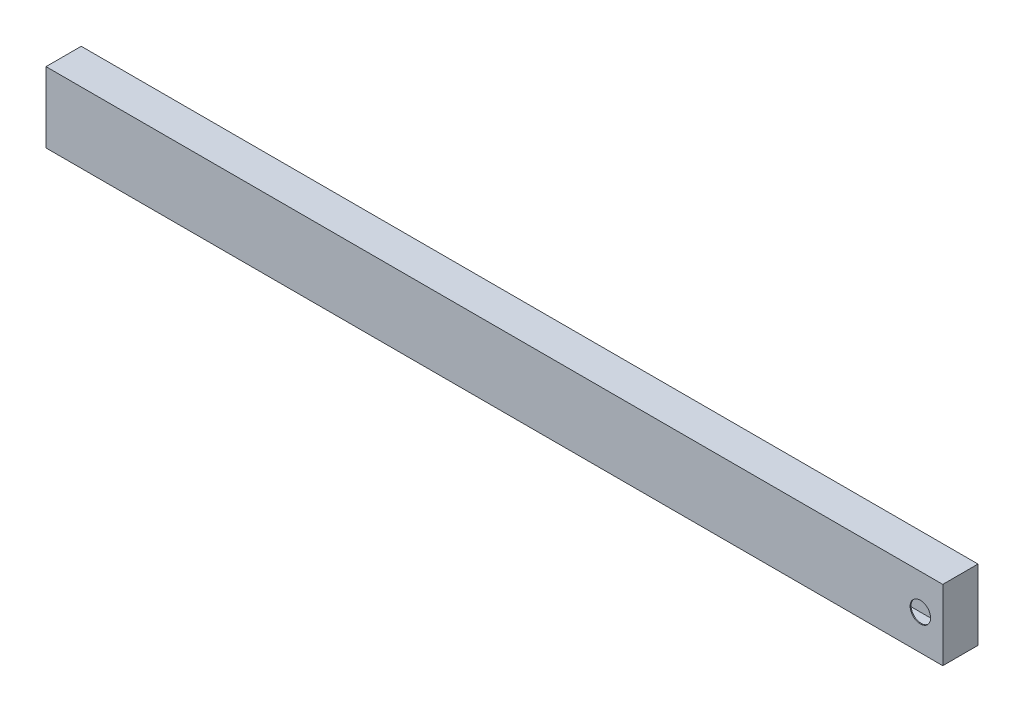
from build123d import *

# Parameters (mm, degrees)
SKETCH_1_W          = 1400
SKETCH_1_H          = 55
EXTRUDE_1_DEPTH     = 110
SKETCH_3_R          = 30
SKETCH_3_R_2        = 2.5
CUT_EXTRUDE_1_DEPTH = 10
CUT_EXTRUDE_START   = -3
SKETCH_4_W          = 52
SKETCH_4_H          = 107
CUT_EXTRUDE_2_DEPTH = 1394
SKETCH_5_R          = 16
CUT_EXTRUDE_3_DEPTH = 10


with BuildPart() as part:
    # Эскиз1 → Бобышка-Вытянуть1 (new body)
    with BuildSketch(Plane(origin=(0, 0, 0), x_dir=(1, 0, 0), z_dir=(0, 1, 0))):
        with Locations((-700, 27.5)):
            Rectangle(SKETCH_1_W, SKETCH_1_H)
    extrude(amount=EXTRUDE_1_DEPTH)

    # Эскиз3 → Вырез-Вытянуть1 (cut)
    with BuildSketch(Plane(origin=(0, 0, -55), x_dir=(-1, 0, 0), z_dir=(0, 0, -1))):
        with Locations((70, 55)):
            Circle(SKETCH_3_R)
        with Locations((175, 55)):
            Circle(SKETCH_3_R)
        with Locations((280, 55)):
            Circle(SKETCH_3_R)
        with Locations((385, 55)):
            Circle(SKETCH_3_R)
        with Locations((490, 55)):
            Circle(SKETCH_3_R)
        with Locations((595, 55)):
            Circle(SKETCH_3_R)
        with Locations((700, 55)):
            Circle(SKETCH_3_R)
        with Locations((805, 55)):
            Circle(SKETCH_3_R)
        with Locations((910, 55)):
            Circle(SKETCH_3_R)
        with Locations((1380, 55)):
            Circle(SKETCH_3_R_2)
        with Locations((1015, 55)):
            Circle(SKETCH_3_R)
        with Locations((1120, 55)):
            Circle(SKETCH_3_R)
        with Locations((1225, 55)):
            Circle(SKETCH_3_R)
        with Locations((1330, 55)):
            Circle(SKETCH_3_R)
    extrude(amount=-CUT_EXTRUDE_1_DEPTH, mode=Mode.SUBTRACT)

    # Эскиз4 → Вырез-Вытянуть2 (cut)
    with BuildSketch(Plane(origin=(0, 0, 0), x_dir=(0, 0, -1), z_dir=(1, 0, 0)).offset(CUT_EXTRUDE_START)):
        with Locations((27.5, 55)):
            Rectangle(SKETCH_4_W, SKETCH_4_H)
    extrude(amount=-CUT_EXTRUDE_2_DEPTH, mode=Mode.SUBTRACT)

    # Эскиз5 → Вырез-Вытянуть3 (cut)
    with BuildSketch(Plane.XY):
        with Locations((-35, 55)):
            Circle(SKETCH_5_R)
    extrude(amount=-CUT_EXTRUDE_3_DEPTH, mode=Mode.SUBTRACT)


solid = part.part
